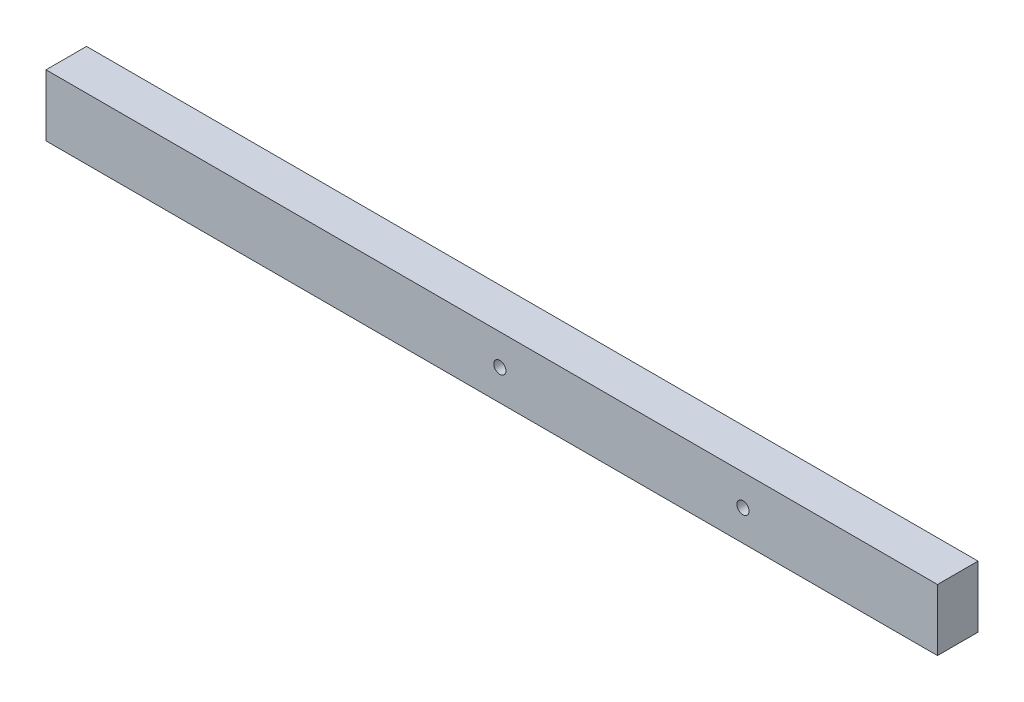
from build123d import *

# Parameters (mm, degrees)
SKETCH_2_W      = 55
SKETCH_2_H      = 3.8
SKETCH_2_R      = 0.375
EXTRUDE_1_DEPTH = 2.5


with BuildPart() as part:
    # 草图2 → 凸台-拉伸1 (new body)
    with BuildSketch(Plane.XY):
        with Locations((-27.5, 0)):
            Rectangle(SKETCH_2_W, SKETCH_2_H)
        with Locations((-12, 0)):
            Circle(SKETCH_2_R, mode=Mode.SUBTRACT)
        with Locations((-27, 0)):
            Circle(SKETCH_2_R, mode=Mode.SUBTRACT)
    extrude(amount=EXTRUDE_1_DEPTH)


solid = part.part
